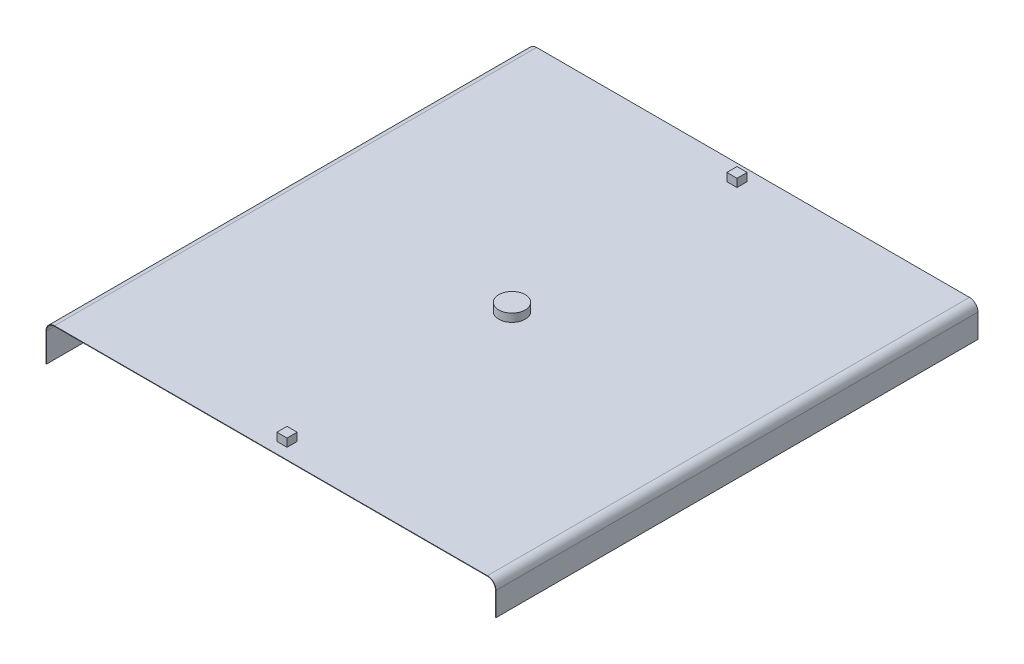
from build123d import *

# Parameters (mm, degrees)
BASE_FLANGE1_DEPTH           = 762
EDGE_FLANGE1_STRIP_W         = 28.3464
EDGE_FLANGE1_STRIP_H         = 0.7366
EDGE_FLANGE1_STRIP_CUT_DEPTH = 762
EDGE_FLANGE1_DEPTH           = 762
SKETCH9_R                    = 20.955
SKETCH9_W                    = 16.002
SKETCH9_H                    = 16.002
BOSS_EXTRUDE2_DEPTH          = 12.7


# Sheet-metal steps are written as plain solids
with BuildPart() as part:
    # Sketch3 → Base-Flange1 (new body)
    with BuildSketch(Plane.XY):
        with BuildLine():
            Line((-555.625, 0), (142.1384, 0))
            ThreePointArc((142.1384, 0), (151.639510976, -3.935489024), (155.575, -13.4366))
            Line((155.575, -13.4366), (155.575, -50.8))
            Line((155.575, -50.8), (154.8384, -50.8))
            Line((154.8384, -50.8), (154.8384, -13.4366))
            ThreePointArc((154.8384, -13.4366), (151.118656121, -4.456343879), (142.1384, -0.7366))
            Line((142.1384, -0.7366), (-555.625, -0.7366))
            Line((-555.625, -0.7366), (-555.625, 0))
        make_face()
    extrude(amount=BASE_FLANGE1_DEPTH)

    # Edge-Flange1 strip (across the edge) → Edge-Flange1 strip cut (cut)
    with BuildSketch(Plane(origin=(-555.625, -0.7366, 762), x_dir=(1, 0, 0), z_dir=(0, 0, -1))):
        with Locations((-0.7366, -0.3683)):
            Rectangle(EDGE_FLANGE1_STRIP_W, EDGE_FLANGE1_STRIP_H)
    extrude(amount=EDGE_FLANGE1_STRIP_CUT_DEPTH, mode=Mode.SUBTRACT)

    # Edge-Flange1 section (across the edge) → Edge-Flange1 (add)
    with BuildSketch(Plane(origin=(-555.625, -0.7366, 762), x_dir=(1, 0, 0), z_dir=(0, 0, -1))):
        with BuildLine():
            Line((0, 12.7), (0, 58.1914))
            Line((0, 58.1914), (0.7366, 58.1914))
            Line((0.7366, 58.1914), (0.7366, 12.7))
            ThreePointArc((0.7366, 12.7), (4.456343879, 3.719743879), (13.4366, 0))
            Line((13.4366, 0), (13.4366, -0.7366))
            ThreePointArc((13.4366, -0.7366), (3.935489024, 3.198889024), (0, 12.7))
        make_face()
    extrude(amount=EDGE_FLANGE1_DEPTH)

    # Sketch9 → Boss-Extrude2 (add)
    with BuildSketch(Plane(origin=(0, 0, 0), x_dir=(1, 0, 0), z_dir=(0, 1, 0))):
        with Locations(Location((-200.025, -381, 0), (0, 0, 270))):
            Circle(SKETCH9_R)
        with Locations((-200.025, -736.6)):
            Rectangle(SKETCH9_W, SKETCH9_H)
        with Locations((-200.025, -25.4)):
            Rectangle(SKETCH9_W, SKETCH9_H)
    extrude(amount=BOSS_EXTRUDE2_DEPTH)


solid = part.part
